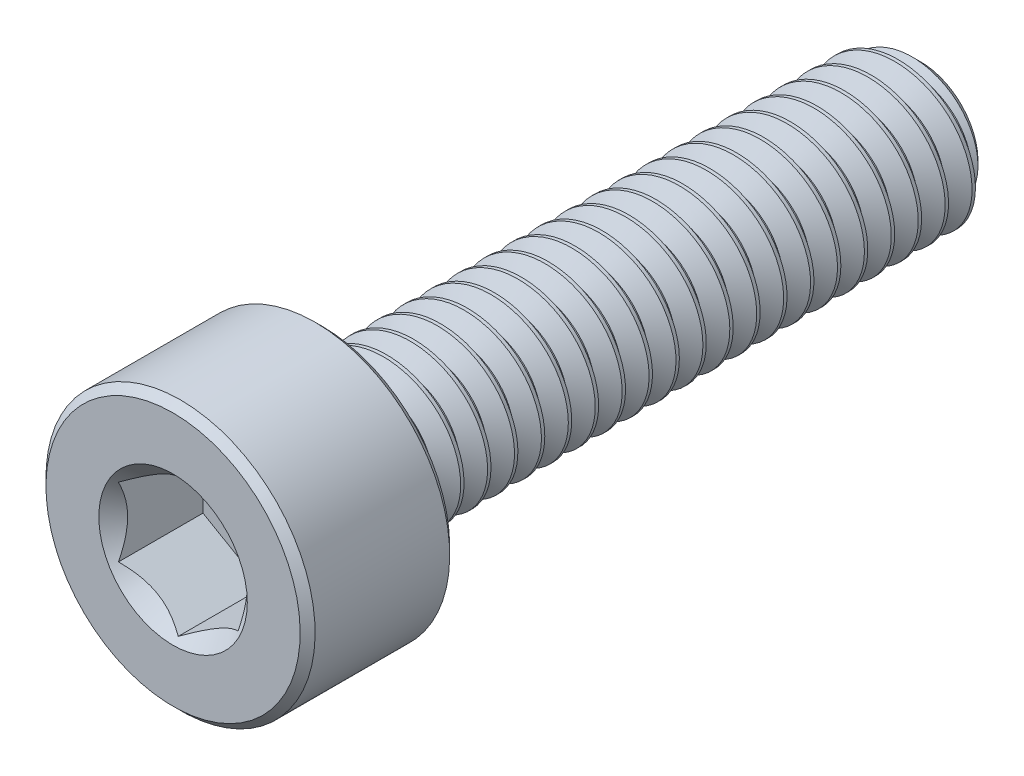
from build123d import *

# Parameters (mm, degrees)
CUT_EXTRUDE1_DEPTH     = 1.5
SPLIT1_SURFACE_1_BACK  = 15.027
SPLIT1_SURFACE_1_DEPTH = 30.054
SPLIT1_SURFACE_2_BACK  = 15.027
SPLIT1_SURFACE_2_DEPTH = 30.054
CUT_SWEEP1_PITCH       = 0.45


with BuildPart() as part:
    # Sketch2 → Revolve1 (revolve)
    with BuildSketch(Plane(origin=(0, 0, 0), x_dir=(0, 0, -1), z_dir=(1, 0, 0))):
        with BuildLine():
            Line((-6.25, 0), (-6.25, 2.125))
            Line((-6.25, 2.125), (-6.125, 2.25))
            Line((-6.125, 2.25), (-3.875, 2.25))
            Line((-3.875, 2.25), (-3.75, 2.125))
            Line((-3.75, 2.125), (-3.75, 1.375))
            ThreePointArc((-3.75, 1.375), (-3.713388348, 1.286611652), (-3.625, 1.25))
            Line((-3.625, 1.25), (5.957716426, 1.25))
            Line((5.957716426, 1.25), (6.25, 0.957716426))
            Line((6.25, 0.957716426), (6.25, 0))
            Line((6.25, 0), (-6.25, 0))
        make_face()
    revolve(axis=Axis((0, 0, -6.25), (0, 0, 1)))

    # Sketch3 → Cut-Extrude1 (cut)
    with BuildSketch(Plane.XY.offset(6.25)):
        Polygon((1, -0.577350269), (1, 0.577350269), (0, 1.154700538), (-1, 0.577350269), (-1, -0.577350269), (0, -1.154700538), align=None)
    extrude(amount=-CUT_EXTRUDE1_DEPTH, mode=Mode.SUBTRACT)

    # Cut-Extrude2 cone 1 section (through the dimple's axis) → Cut-Extrude2 (revolve, cut)
    with BuildSketch(Plane(origin=(0, 0, 6.25), x_dir=(0, -1, 0), z_dir=(1, 0, 0))):
        Polygon((0, 0), (1.241303079, 0), (0, 1.241303079), align=None)
    revolve(axis=Axis((0, 0, 6.25), (0, 0, -1)), mode=Mode.SUBTRACT)


with BuildPart() as body_2:
    # Split1: the piece behind the surface
    add(part.part)
    # Split1 surface: a surface, the sketch's curves swept straight by 30.054 mm
    with BuildLine(Plane(origin=(0, 0, 0), x_dir=(0, 0, -1), z_dir=(1, 0, 0)).offset(-SPLIT1_SURFACE_1_BACK), mode=Mode.PRIVATE) as split1_surface_1_path:
        Line((-3.625, -2.25), (-3.625, 2.25))
    split1_surface_1 = Shell.extrude(split1_surface_1_path.wire(), (1 * SPLIT1_SURFACE_1_DEPTH, 0 * SPLIT1_SURFACE_1_DEPTH, 0 * SPLIT1_SURFACE_1_DEPTH))
    split(bisect_by=split1_surface_1, keep=Keep.BOTTOM)

    # Cut-Sweep1: the profile of Sketch7 screwed along a right-hand helix of 23.222222 turns, 6 arcs to a turn; built about Z, then put on its axis
    cut_sweep1_z = Axis((0, 0, 0), (0, 0, 1))
    cut_sweep1_corners = [(1.274356964, 0, 0.0140625), (1.274356964, 0, -0.4078125), (0.957716426, 0, -0.225), (0.957716426, 0, -0.16875)]
    with BuildLine(mode=Mode.PRIVATE) as cut_sweep1_profile:
        Line(cut_sweep1_corners[0], cut_sweep1_corners[1])
        Line(cut_sweep1_corners[1], cut_sweep1_corners[2])
        Line(cut_sweep1_corners[2], cut_sweep1_corners[3])
        Line(cut_sweep1_corners[3], cut_sweep1_corners[0])
    cut_sweep1_cap = Face(cut_sweep1_profile.wire())
    cut_sweep1_turn_angles = [0, 30, 60, 90, 120, 150, 180, 210, 240, 270, 300, 330, 360]
    cut_sweep1_turn_weights = [1, 0.8660254037844387, 1, 0.8660254037844387, 1, 0.8660254037844387, 1, 0.8660254037844387, 1, 0.8660254037844387, 1, 0.8660254037844387, 1]
    cut_sweep1_turn_rails = [Edge.make_bspline([Vector(p[0], p[1], 0).rotate(cut_sweep1_z, cut_sweep1_turn_angles[k]) / cut_sweep1_turn_weights[k] + Vector(0, 0, p[2] + CUT_SWEEP1_PITCH * cut_sweep1_turn_angles[k] / 360) for k in range(13)], [0, 0, 0, 1, 1, 2, 2, 3, 3, 4, 4, 5, 5, 6, 6, 6], 2, cut_sweep1_turn_weights) for p in cut_sweep1_corners]
    cut_sweep1_turn_sides = [Face.make_surface_from_curves(cut_sweep1_turn_rails[p[0]], cut_sweep1_turn_rails[p[1]]) for p in [(0, 1), (1, 2), (2, 3), (3, 0)]]
    cut_sweep1_turn = Solid(Shell([*cut_sweep1_turn_sides, cut_sweep1_cap, cut_sweep1_cap.rotate(cut_sweep1_z, 360).moved(Location((0, 0, CUT_SWEEP1_PITCH * 360 / 360)))]))
    cut_sweep1_last_angles = [8280, 8310, 8340, 8350, 8360]
    cut_sweep1_last_weights = [1, 0.8660254037844387, 1, 0.9848077530121667, 1]
    cut_sweep1_last_rails = [Edge.make_bspline([Vector(p[0], p[1], 0).rotate(cut_sweep1_z, cut_sweep1_last_angles[k]) / cut_sweep1_last_weights[k] + Vector(0, 0, p[2] + CUT_SWEEP1_PITCH * cut_sweep1_last_angles[k] / 360) for k in range(5)], [0, 0, 0, 1, 1, 2, 2, 2], 2, cut_sweep1_last_weights) for p in cut_sweep1_corners]
    cut_sweep1_last_sides = [Face.make_surface_from_curves(cut_sweep1_last_rails[p[0]], cut_sweep1_last_rails[p[1]]) for p in [(0, 1), (1, 2), (2, 3), (3, 0)]]
    cut_sweep1_last = Solid(Shell([*cut_sweep1_last_sides, cut_sweep1_cap.rotate(cut_sweep1_z, 8280).moved(Location((0, 0, CUT_SWEEP1_PITCH * 8280 / 360))), cut_sweep1_cap.rotate(cut_sweep1_z, 8360).moved(Location((0, 0, CUT_SWEEP1_PITCH * 8360 / 360)))]))
    cut_sweep1_each = [*[cut_sweep1_turn.moved(Location((0, 0, CUT_SWEEP1_PITCH * i))) for i in range(23)], cut_sweep1_last]
    add(Plane(origin=(0, 0, -6.25), x_dir=(0, 1, 0), z_dir=(0, 0, 1)) * Compound([cut_sweep1_each[i] for i in range(0, 24, 2)]), mode=Mode.SUBTRACT)
    add(Plane(origin=(0, 0, -6.25), x_dir=(0, 1, 0), z_dir=(0, 0, 1)) * Compound([cut_sweep1_each[i] for i in range(1, 24, 2)]), mode=Mode.SUBTRACT)


with BuildPart() as part_1:
    add(part.part)

    # Split1: split by a surface, the side it looks to stays
    # Split1 surface: a surface, the sketch's curves swept straight by 30.054 mm
    with BuildLine(Plane(origin=(0, 0, 0), x_dir=(0, 0, -1), z_dir=(1, 0, 0)).offset(-SPLIT1_SURFACE_2_BACK), mode=Mode.PRIVATE) as split1_surface_2_path:
        Line((-3.625, -2.25), (-3.625, 2.25))
    split1_surface_2 = Shell.extrude(split1_surface_2_path.wire(), (1 * SPLIT1_SURFACE_2_DEPTH, 0 * SPLIT1_SURFACE_2_DEPTH, 0 * SPLIT1_SURFACE_2_DEPTH))
    split(bisect_by=split1_surface_2, keep=Keep.TOP)

    add(body_2.part)  # Revolve2 merges body 2
    # Sketch8 → Revolve2 (revolve)
    with BuildSketch(Plane(origin=(0, 0, 0), x_dir=(0, 0, -1), z_dir=(1, 0, 0)), mode=Mode.PRIVATE) as revolve2_sk:
        Polygon((-3.75, 0), (-3.75, 1.25), (-3.625, 1.25), (-2.903312164, 0), align=None)
    revolve(revolve2_sk.sketch.rotate(Axis((0, 0, 2.903312164), (0, 0, 1)), 270), axis=Axis((0, 0, 2.903312164), (0, 0, 1)))


solid = part_1.part
